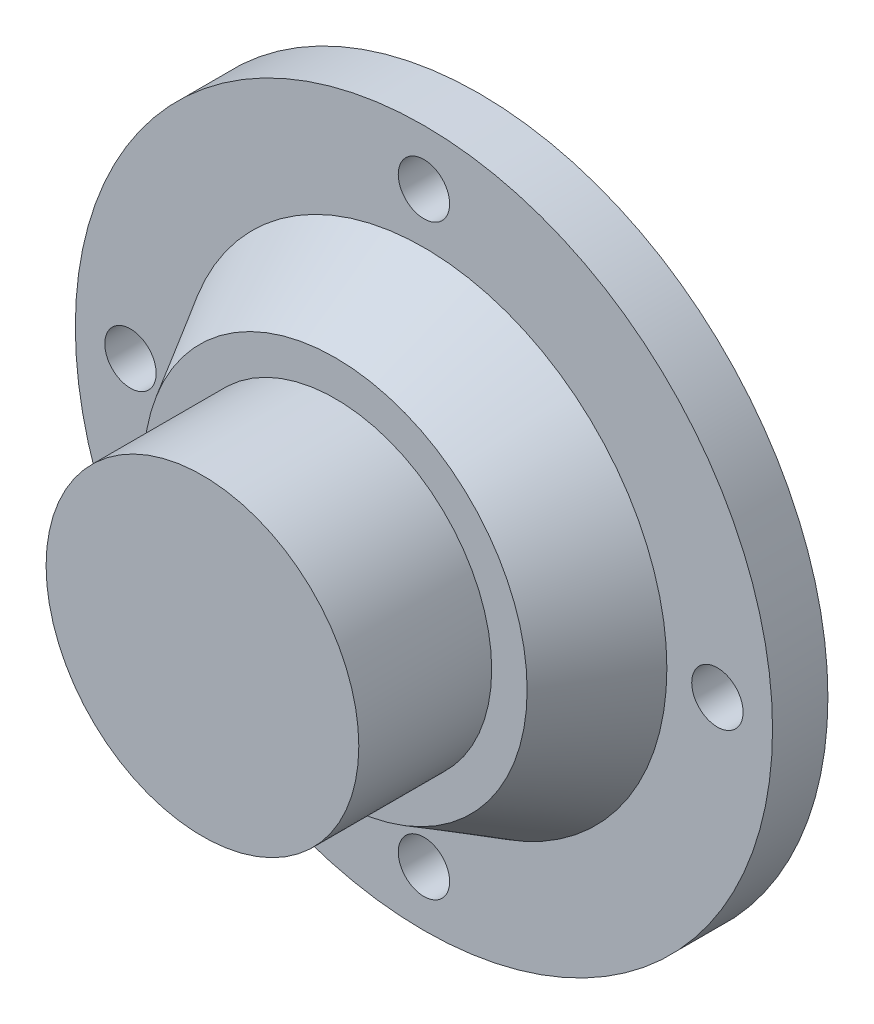
from build123d import *

# Parameters (mm, degrees)
F_4_CLEARANCE_HOLE1_D = 2.9464


with BuildPart() as part:
    # Sketch2 → Revolve1 (revolve)
    with BuildSketch(Plane(origin=(0, 0, 0), x_dir=(0, 0, -1), z_dir=(1, 0, 0))):
        Polygon((0, 0), (15.875, 0), (15.875, 17.280736743), (15.875, 19.9898), (12.7, 19.9898), (12.7, 13.931139367), (7.62, 10.9982), (7.62, 8.9662), (0, 8.9662), align=None)
    revolve(axis=Axis((0, 0, 0), (0, 0, -1)))

    # #4 Clearance Hole1 (through all)
    with Locations(Plane(origin=(0, 0, -15.875), x_dir=(-1, 0, 0), z_dir=(0, 0, -1))):
        with Locations((0, 16.8275), (-16.8275, 0), (16.8275, 0), (0, -16.8275)):
            Hole(F_4_CLEARANCE_HOLE1_D / 2)


solid = part.part
